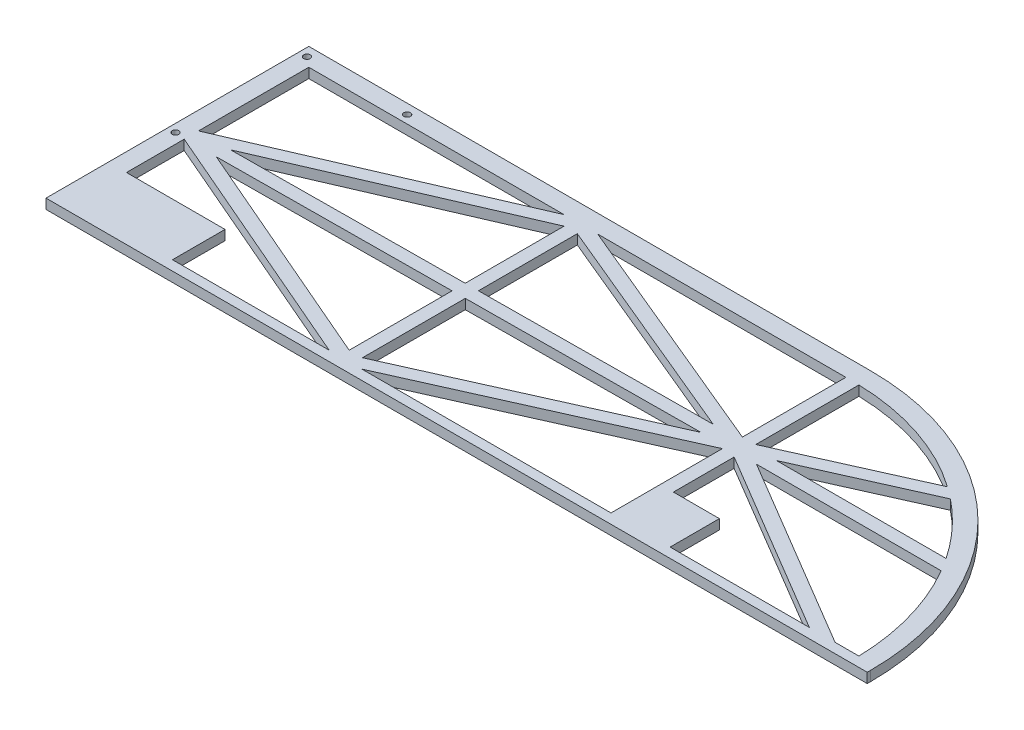
from build123d import *

# Parameters (mm, degrees)
SKETCH_1_R          = 1
EXTRUDE_1_DEPTH     = 3
CUT_EXTRUDE_2_DEPTH = 18


with BuildPart() as part:
    # 草图1 → 凸台-拉伸1 (new body)
    with BuildSketch(Plane(origin=(0, 0, 0), x_dir=(1, 0, 0), z_dir=(0, 1, 0))):
        with BuildLine():
            Line((46, 40), (-125, 40))
            Line((-125, 40), (-125, -40))
            Line((-125, -40), (125, -40))
            Line((125, -40), (125, -39))
            ThreePointArc((125, -39), (101.861435714, 16.861435714), (46, 40))
        make_face()
        with Locations((-122.557778193, -3)):
            Circle(SKETCH_1_R, mode=Mode.SUBTRACT)
        with Locations((-122.557778193, 37)):
            Circle(SKETCH_1_R, mode=Mode.SUBTRACT)
        with Locations((-92.057778193, 37)):
            Circle(SKETCH_1_R, mode=Mode.SUBTRACT)
    extrude(amount=EXTRUDE_1_DEPTH)

    # 草图4 → 切除-拉伸2 (cut)
    with BuildSketch(Plane(origin=(0, 0, 0), x_dir=(1, 0, 0), z_dir=(0, 1, 0))):
        Polygon((-119.5, 0.928664621), (-41.792923004, 34.5), (-119.5, 34.5), align=None)
        Polygon((-38.75, 1.359951305), (-38.75, 31.457287041), (-109.655467107, 0.824411523), align=None)
        Polygon((-38.75, -33.957287041), (-38.75, -2.640162785), (-109.993767206, -3.178257704), align=None)
        Polygon((-41.792923004, -37), (-119.5, -3.428664621), (-119.5, -21), (-89.5, -21), (-89.5, -37), align=None)
        Polygon((36.466110428, -2.072065274), (-34.75, -2.609951305), (-34.75, -33.914918275), align=None)
        Polygon((36.183276387, 1.925912607), (-34.75, 31.499302762), (-34.75, 1.390162785), align=None)
        Polygon((44, 34.5), (-31.552675466, 34.5), (44, 3.000697238), align=None)
        Polygon((44, -37), (44, -3.085081725), (-31.850256413, -37), align=None)
        with BuildLine():
            ThreePointArc((88.303028844, 21.105771359), (69.137822898, 30.763107382), (48, 34.472784077))
            Line((48, 34.472784077), (48, 3.085081725))
            Line((48, 3.085081725), (88.303028844, 21.105771359))
        make_face()
        with BuildLine():
            ThreePointArc((107.002049146, 2), (100.102344178, 10.751244752), (91.958901571, 18.358777588))
            Line((91.958901571, 18.358777588), (90.984456555, 17.923074076))
            Line((90.984456555, 17.923074076), (55.37271656, 2))
            Line((55.37271656, 2), (107.002049146, 2))
        make_face()
        with BuildLine():
            ThreePointArc((119.472784077, -37), (116.690700516, -18.873528363), (109.507873528, -2))
            Line((109.507873528, -2), (108.299678972, -2))
            Line((108.299678972, -2), (53.284231775, -2))
            Line((53.284231775, -2), (109.320951684, -35.28040643))
            Line((109.320951684, -35.28040643), (112.216360533, -37))
            Line((112.216360533, -37), (119.472784077, -37))
        make_face()
        Polygon((104.382997411, -37), (48, -3.513938135), (48, -22), (62, -22), (62, -37), align=None)
    extrude(amount=CUT_EXTRUDE_2_DEPTH, mode=Mode.SUBTRACT)


solid = part.part
